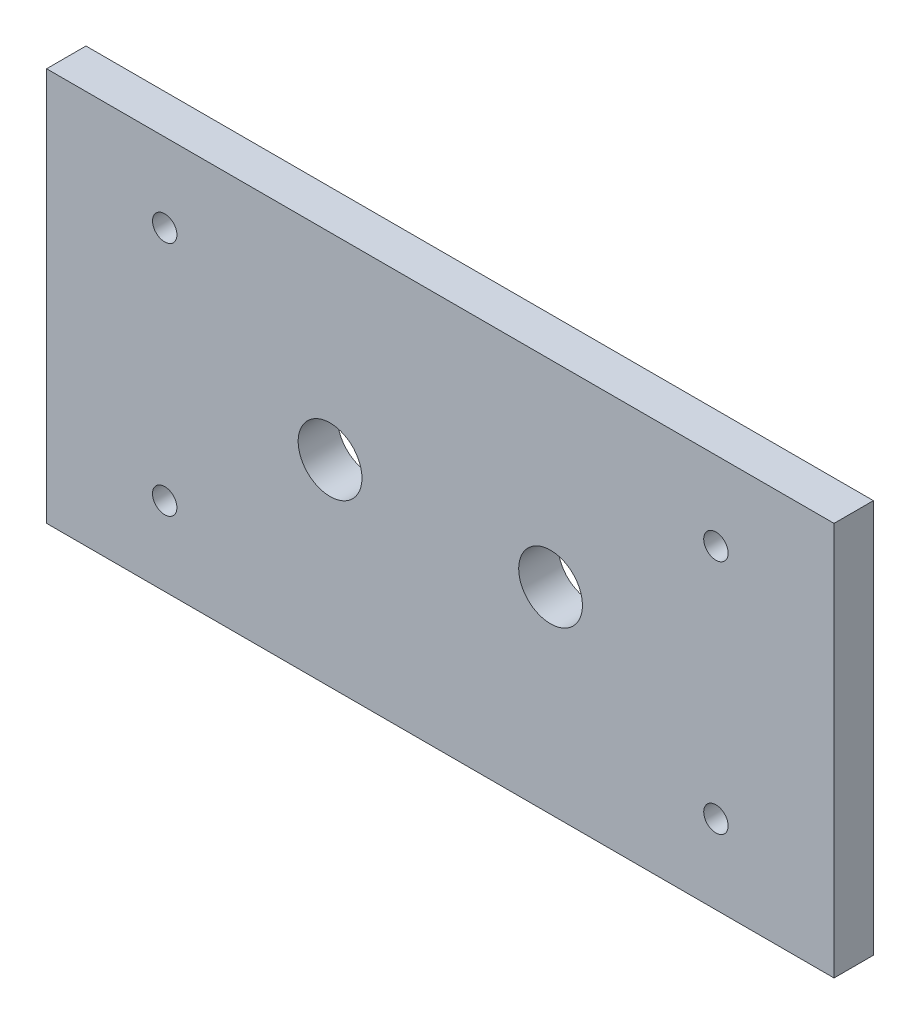
from build123d import *

# Parameters (mm, degrees)
ESQUISSE1_W        = 100
ESQUISSE1_H        = 50
ESQUISSE1_R        = 1.55
ESQUISSE1_R_2      = 4.05
BOSS_EXTRU_1_DEPTH = 5


with BuildPart() as part:
    # Esquisse1 → Boss.-Extru.1 (new body)
    with BuildSketch(Plane.XY):
        Rectangle(ESQUISSE1_W, ESQUISSE1_H)
        with Locations((-35, -15)):
            Circle(ESQUISSE1_R, mode=Mode.SUBTRACT)
        with Locations((-35, 15)):
            Circle(ESQUISSE1_R, mode=Mode.SUBTRACT)
        with Locations((35, -15)):
            Circle(ESQUISSE1_R, mode=Mode.SUBTRACT)
        with Locations((35, 15)):
            Circle(ESQUISSE1_R, mode=Mode.SUBTRACT)
        with Locations((-14, 0)):
            Circle(ESQUISSE1_R_2, mode=Mode.SUBTRACT)
        with Locations((14, 0)):
            Circle(ESQUISSE1_R_2, mode=Mode.SUBTRACT)
    extrude(amount=-BOSS_EXTRU_1_DEPTH)


solid = part.part
